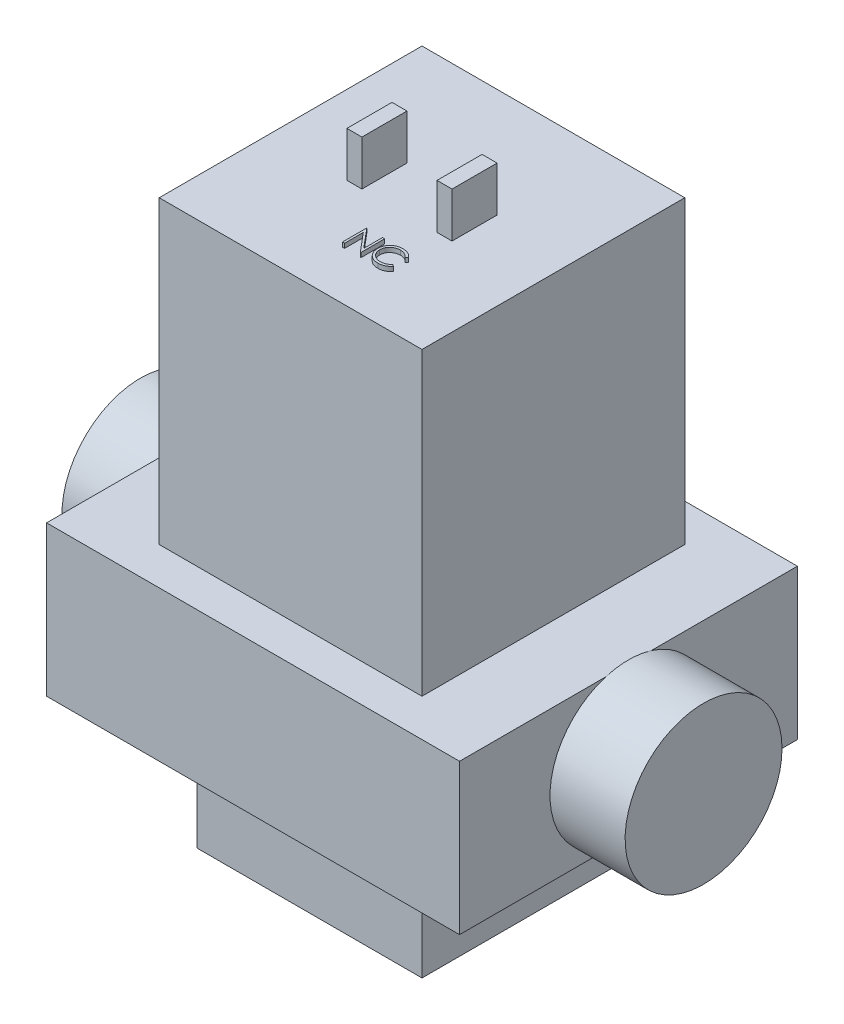
from build123d import *

# Parameters (mm, degrees)
VALVE_BODY_START   = 15
SKETCH1_W          = 55
SKETCH1_H          = 45
VALVE_BODY_DEPTH   = 20
COIL_START         = 35
SKETCH2_W          = 35
SKETCH2_H          = 35
COIL_DEPTH         = 40
PORT_IN_G12_START  = -37.5
SKETCH3_R          = 10.45
PORT_IN_G12_DEPTH  = 10
PORT_OUT_G12_START = 27.5
SKETCH4_R          = 10.45
PORT_OUT_G12_DEPTH = 10
SKETCH5_W          = 30
SKETCH5_H          = 30
MOUNT_FOOT_DEPTH   = 15
SPADE_1_START      = 75
SKETCH6_W          = 2
SKETCH6_H          = 6
SPADE_1_DEPTH      = 6
SPADE_2_START      = 75
SKETCH7_W          = 2
SKETCH7_H          = 6
SPADE_2_DEPTH      = 6
LABEL_NC_START     = 75
LABEL_NC_DEPTH     = 0.6
FLOW_ARROW_START   = 35
FLOW_ARROW_DEPTH   = 0.6


# Read off the part's stored shape, not the designer's step: Label_NC
with BuildPart() as part:
    # Sketch1 → Valve_Body (new body)
    with BuildSketch(Plane(origin=(0, 0, 0), x_dir=(1, 0, 0), z_dir=(0, 1, 0)).offset(VALVE_BODY_START)):
        Rectangle(SKETCH1_W, SKETCH1_H)
    extrude(amount=VALVE_BODY_DEPTH)

    # Sketch2 → Coil (add)
    with BuildSketch(Plane(origin=(0, 0, 0), x_dir=(1, 0, 0), z_dir=(0, 1, 0)).offset(COIL_START)):
        Rectangle(SKETCH2_W, SKETCH2_H)
    extrude(amount=COIL_DEPTH)

    # Sketch3 → Port_In_G12 (add)
    with BuildSketch(Plane(origin=(0, 0, 0), x_dir=(0, 0, -1), z_dir=(1, 0, 0)).offset(PORT_IN_G12_START)):
        with Locations(Location((0, 25, 0), (0, 0, 253.124499321))):
            Circle(SKETCH3_R)
    extrude(amount=PORT_IN_G12_DEPTH)

    # Sketch4 → Port_Out_G12 (add)
    with BuildSketch(Plane(origin=(0, 0, 0), x_dir=(0, 0, -1), z_dir=(1, 0, 0)).offset(PORT_OUT_G12_START)):
        with Locations(Location((0, 25, 0), (0, 0, 253.124499321))):
            Circle(SKETCH4_R)
    extrude(amount=PORT_OUT_G12_DEPTH)

    # Sketch5 → Mount_Foot (add)
    with BuildSketch(Plane(origin=(0, 0, 0), x_dir=(1, 0, 0), z_dir=(0, 1, 0))):
        Rectangle(SKETCH5_W, SKETCH5_H)
    extrude(amount=MOUNT_FOOT_DEPTH)

    # Sketch6 → Spade_1 (add)
    with BuildSketch(Plane(origin=(0, 0, 0), x_dir=(1, 0, 0), z_dir=(0, 1, 0)).offset(SPADE_1_START)):
        with Locations((-6, 0)):
            Rectangle(SKETCH6_W, SKETCH6_H)
    extrude(amount=SPADE_1_DEPTH)

    # Sketch7 → Spade_2 (add)
    with BuildSketch(Plane(origin=(0, 0, 0), x_dir=(1, 0, 0), z_dir=(0, 1, 0)).offset(SPADE_2_START)):
        with Locations((6, 0)):
            Rectangle(SKETCH7_W, SKETCH7_H)
    extrude(amount=SPADE_2_DEPTH)

    # Label_NC outline → Label_NC (add)
    with BuildSketch(Plane(origin=(0, 0, 0), x_dir=(1, 0, 0), z_dir=(0, 1, 0)).offset(LABEL_NC_START)):
        with BuildLine():
            add(Edge.make_bspline(
                [(5.208984375, -7.743589744), (5.245464646, -7.744027112), (5.317673669, -7.744892838), (5.424492146, -7.753334838), (5.528489114, -7.767407896), (5.629736219, -7.786563187), (5.728726021, -7.810336972), (5.824701954, -7.8413071), (5.918227191, -7.87671881), (6.008711886, -7.917502561), (6.0957219, -7.963283105), (6.179230132, -8.013552993), (6.258573253, -8.068249902), (6.334309566, -8.12690864), (6.405172129, -8.19077019), (6.473172899, -8.258078009), (6.536002591, -8.330770835), (6.574785846, -8.381938168), (6.594230769, -8.407592147)],
                knots=[0, 0, 0, 0, 0.068547537, 0.135682946, 0.20121499, 0.265682235, 0.329266835, 0.392395428, 0.455069762, 0.51712685, 0.578790035, 0.639739863, 0.700191504, 0.759806243, 0.819628319, 0.879354791, 0.939511608, 1, 1, 1, 1], degree=3))
            add(Edge.make_bspline(
                [(3.500641026, -9.394055489), (3.502051808, -9.336945899), (3.504827435, -9.224586346), (3.528409335, -9.059691402), (3.566344958, -8.901711205), (3.620226421, -8.750940665), (3.688539133, -8.606586768), (3.772927561, -8.469752247), (3.872411326, -8.339562007), (3.98621019, -8.217991482), (4.111003416, -8.106830784), (4.244642626, -8.009035156), (4.386866249, -7.927648553), (4.536107443, -7.85961632), (4.69348374, -7.807324557), (4.858659368, -7.770718451), (5.031323955, -7.747933639), (5.149127727, -7.745053272), (5.208984375, -7.743589744)],
                knots=[0, 0, 0, 0, 0.064557846, 0.127013532, 0.18795481, 0.248013913, 0.307747682, 0.368234515, 0.429469844, 0.492743437, 0.556257769, 0.618216786, 0.679655476, 0.741245546, 0.803415265, 0.866815462, 0.932328312, 1, 1, 1, 1], degree=3))
            add(Edge.make_bspline(
                [(3.903240184, -10.526166867), (3.871094993, -10.486668788), (3.807192697, -10.408149487), (3.725435826, -10.280890061), (3.655451973, -10.148022472), (3.598868102, -10.008848679), (3.554633337, -9.863680978), (3.523988967, -9.71244619), (3.504075726, -9.555285556), (3.501798535, -9.448390755), (3.500641026, -9.394055489)],
                knots=[0, 0, 0, 0, 0.12432851, 0.247156016, 0.368779749, 0.490733862, 0.613613772, 0.738957576, 0.867310575, 1, 1, 1, 1], degree=3))
            add(Edge.make_bspline(
                [(5.212800481, -11.081410256), (5.178652297, -11.081172592), (5.111128492, -11.080702639), (5.011434625, -11.073089745), (4.914379791, -11.062703197), (4.82024138, -11.047063936), (4.728505674, -11.028608713), (4.640004287, -11.003869787), (4.553866346, -10.976157329), (4.470437923, -10.943586377), (4.389648052, -10.906832411), (4.311757309, -10.865292926), (4.236801517, -10.819317234), (4.164043742, -10.76991876), (4.094558791, -10.715510779), (4.027744522, -10.656848904), (3.963226276, -10.594130851), (3.923309554, -10.548905377), (3.903240184, -10.526166867)],
                knots=[0, 0, 0, 0, 0.069662801, 0.137749562, 0.203916744, 0.268779862, 0.332413706, 0.39475354, 0.456180032, 0.516995649, 0.577395938, 0.637198344, 0.696999184, 0.756756194, 0.816553905, 0.876947997, 0.938131788, 1, 1, 1, 1], degree=3))
            add(Edge.make_bspline(
                [(6.594230769, -10.4154998), (6.574166484, -10.441388252), (6.53413402, -10.493041154), (6.46931139, -10.565859062), (6.401024128, -10.634352008), (6.328765019, -10.697967779), (6.253365308, -10.75797933), (6.173471139, -10.812681706), (6.090132803, -10.862838436), (6.003632668, -10.908764289), (5.914062641, -10.949510649), (5.821530046, -10.98439371), (5.726433738, -11.014442717), (5.62876937, -11.039164117), (5.528334362, -11.058460028), (5.425491146, -11.071359305), (5.32001776, -11.080196613), (5.248860185, -11.081002079), (5.212800481, -11.081410256)],
                knots=[0, 0, 0, 0, 0.061674239, 0.123053062, 0.183475001, 0.243726501, 0.304278917, 0.364862921, 0.425946204, 0.48739123, 0.549220384, 0.611143589, 0.67352853, 0.736961457, 0.800785283, 0.866012596, 0.932100748, 1, 1, 1, 1], degree=3))
            Line((6.594230769, -10.4154998), (6.344911859, -10.226602564))
            add(Edge.make_bspline(
                [(5.210892428, -10.755769231), (5.266321296, -10.754237266), (5.375418567, -10.751221994), (5.535409563, -10.725677532), (5.688567722, -10.684259278), (5.834901282, -10.626294734), (5.973997711, -10.550942652), (6.106074682, -10.459595291), (6.231243678, -10.351383732), (6.306510484, -10.268758323), (6.344911859, -10.226602564)],
                knots=[0, 0, 0, 0, 0.12851519, 0.252948636, 0.374754734, 0.495939754, 0.617180641, 0.740909469, 0.867811148, 1, 1, 1, 1], degree=3))
            add(Edge.make_bspline(
                [(3.785576923, -9.415680088), (3.786721573, -9.462607785), (3.788968942, -9.554744095), (3.808969931, -9.689700291), (3.839363835, -9.818986903), (3.884916537, -9.941795759), (3.941085961, -10.059641199), (4.012061373, -10.170529301), (4.094263518, -10.276135756), (4.188855313, -10.373964716), (4.292637731, -10.463330738), (4.403987623, -10.542025909), (4.522627655, -10.607625838), (4.647247884, -10.662214018), (4.778807287, -10.704175478), (4.917069287, -10.73371579), (5.061733168, -10.752985482), (5.160583981, -10.754830328), (5.210892428, -10.755769231)],
                knots=[0, 0, 0, 0, 0.064323217, 0.126290104, 0.186726469, 0.246146432, 0.305575643, 0.365429386, 0.426326309, 0.488839906, 0.551724972, 0.613918596, 0.675483766, 0.737333897, 0.800229044, 0.864502298, 0.931040739, 1, 1, 1, 1], degree=3))
            add(Edge.make_bspline(
                [(5.191175881, -8.069230769), (5.159350317, -8.069597221), (5.095994559, -8.070326723), (5.001970587, -8.079950715), (4.909702319, -8.093477313), (4.819249775, -8.113548142), (4.730728091, -8.138923304), (4.643558555, -8.169244929), (4.559003225, -8.206759677), (4.475892395, -8.248223598), (4.39626411, -8.295057066), (4.320921317, -8.346141321), (4.250138803, -8.400904716), (4.183860577, -8.459552505), (4.122018881, -8.521820569), (4.06506182, -8.588372508), (4.013186484, -8.658995551), (3.965364611, -8.732758427), (3.922535917, -8.809446281), (3.886676669, -8.889342952), (3.854922023, -8.971080246), (3.829794853, -9.055581656), (3.809906184, -9.142252594), (3.796183232, -9.231325666), (3.78666869, -9.322614789), (3.785942816, -9.38449038), (3.785576923, -9.415680088)],
                knots=[0, 0, 0, 0, 0.043954909, 0.087501875, 0.130462627, 0.172752021, 0.215403067, 0.25764983, 0.300152749, 0.34312149, 0.385925163, 0.427685727, 0.46881795, 0.5094918, 0.549883031, 0.589980023, 0.63040523, 0.670868626, 0.711383944, 0.751627258, 0.791775577, 0.832458919, 0.873319045, 0.914542956, 0.956923558, 1, 1, 1, 1], degree=3))
            add(Edge.make_bspline(
                [(6.344911859, -8.598397436), (6.327126517, -8.577201163), (6.291795619, -8.53509439), (6.234954771, -8.475967232), (6.175716852, -8.420572316), (6.114104507, -8.368645754), (6.049008734, -8.322003402), (5.982006438, -8.278214616), (5.911976783, -8.238964596), (5.815137709, -8.191373173), (5.688457161, -8.14171059), (5.528986128, -8.100069801), (5.362515346, -8.07356202), (5.248943238, -8.070691057), (5.191175881, -8.069230769)],
                knots=[0, 0, 0, 0, 0.063163259, 0.125474941, 0.18712122, 0.248294346, 0.309294856, 0.369850066, 0.430973376, 0.49245599, 0.616147966, 0.740843698, 0.868182649, 1, 1, 1, 1], degree=3))
            Line((6.344911859, -8.598397436), (6.594230769, -8.407592147))
        make_face()
        Polygon((0.407051282, -7.825), (0.407051282, -11), (0.691987179, -11), (0.691987179, -8.506810897), (2.784485176, -11), (2.849358974, -11), (2.849358974, -7.825), (2.564423077, -7.825), (2.564423077, -10.323913261), (0.466836939, -7.825), align=None)
    extrude(amount=LABEL_NC_DEPTH)

    # Sketch9 → Flow_Arrow (add)
    with BuildSketch(Plane(origin=(0, 0, 0), x_dir=(1, 0, 0), z_dir=(0, 1, 0)).offset(FLOW_ARROW_START)):
        Polygon((-24.5, 16), (-18.5, 16), (-18.5, 19), (-13.5, 14), (-18.5, 9), (-18.5, 12), (-24.5, 12), align=None)
    extrude(amount=FLOW_ARROW_DEPTH)


solid = part.part
